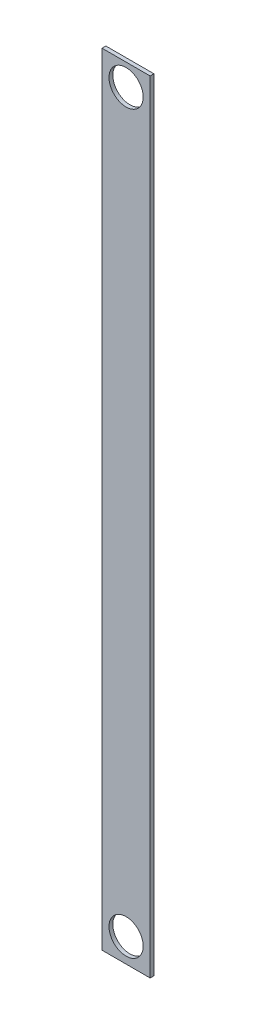
from build123d import *

# Parameters (mm, degrees)
SKETCH1_W           = 40
SKETCH1_H           = 650
BOSS_EXTRUDE1_DEPTH = 3.175
SKETCH2_R           = 14.224
CUT_EXTRUDE1_DEPTH  = 652.237345846


with BuildPart() as part:
    # Sketch1 → Boss-Extrude1 (new body)
    with BuildSketch(Plane.XY):
        with Locations((20, -325)):
            Rectangle(SKETCH1_W, SKETCH1_H)
    extrude(amount=BOSS_EXTRUDE1_DEPTH)

    # Sketch2 → Cut-Extrude1 (cut, through all)
    with BuildSketch(Plane.XY.offset(3.175)):
        with Locations((20, -18.141364063)):
            Circle(SKETCH2_R)
        with Locations((20, -630)):
            Circle(SKETCH2_R)
    extrude(amount=-CUT_EXTRUDE1_DEPTH, mode=Mode.SUBTRACT)


solid = part.part
